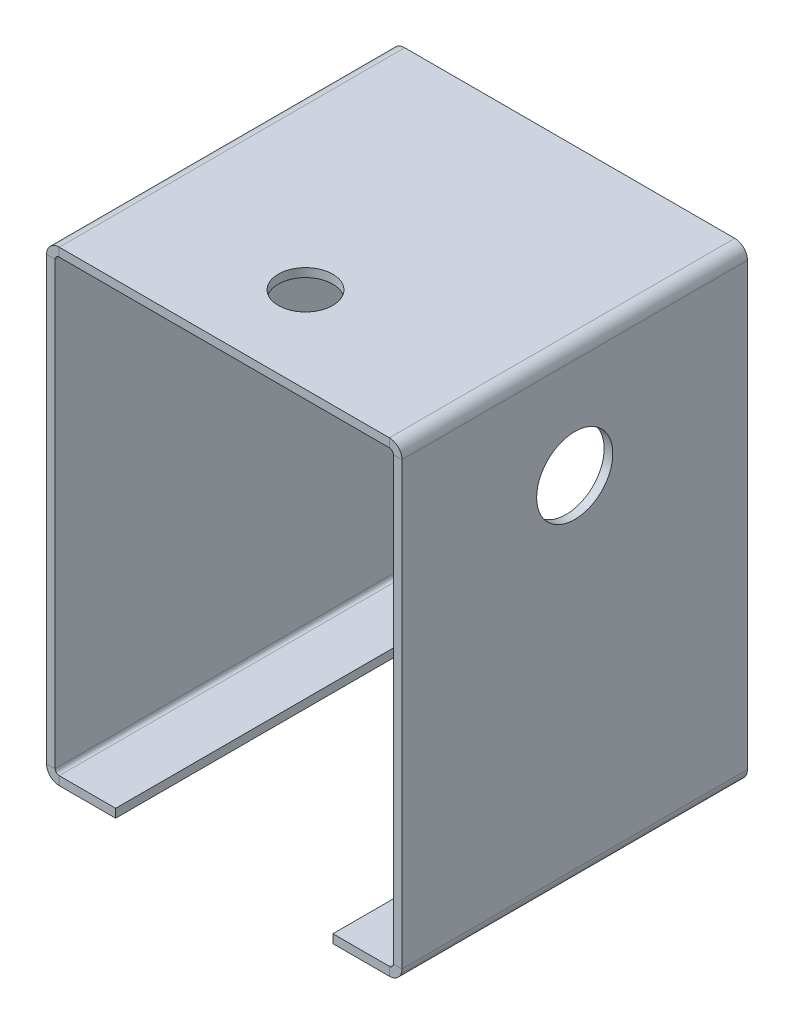
from build123d import *

# Parameters (mm, degrees)
SKETCH2_W                    = 1.5875
SKETCH2_H                    = 82.55
BASE_FLANGE1_DEPTH           = 63.5
EDGE_FLANGE1_STRIP_W         = 7.8232
EDGE_FLANGE1_STRIP_H         = 1.5875
EDGE_FLANGE1_STRIP_CUT_DEPTH = 63.5
EDGE_FLANGE1_DEPTH           = 63.5
SKETCH10_R                   = 7
CUT_EXTRUDE1_DEPTH           = 105.73891424
EDGE_FLANGE2_STRIP_W         = 7.8232
EDGE_FLANGE2_STRIP_H         = 1.5875
EDGE_FLANGE2_STRIP_CUT_DEPTH = 63.5
EDGE_FLANGE2_DEPTH           = 63.5
EDGE_FLANGE3_STRIP_W         = 7.8232
EDGE_FLANGE3_STRIP_H         = 1.5875
EDGE_FLANGE3_STRIP_CUT_DEPTH = 63.5
EDGE_FLANGE3_DEPTH           = 63.5
EDGE_FLANGE4_STRIP_W         = 7.8232
EDGE_FLANGE4_STRIP_H         = 1.5875
EDGE_FLANGE4_STRIP_CUT_DEPTH = 63.5
EDGE_FLANGE4_DEPTH           = 63.5
SKETCH20_R                   = 5
CUT_EXTRUDE2_DEPTH           = 125.278268888
SKETCH21_R                   = 5
CUT_EXTRUDE3_DEPTH           = 9.652


# Sheet-metal steps are written as plain solids
with BuildPart() as part:
    # Sketch2 → Base-Flange1 (new body)
    with BuildSketch(Plane.XY):
        with Locations((0.79375, 41.275)):
            Rectangle(SKETCH2_W, SKETCH2_H)
    extrude(amount=BASE_FLANGE1_DEPTH)

    # Edge-Flange1 strip (across the edge) → Edge-Flange1 strip cut (cut)
    with BuildSketch(Plane(origin=(0, 0, 0), x_dir=(0, 1, 0), z_dir=(0, 0, 1))):
        with Locations((-3.175, -0.79375)):
            Rectangle(EDGE_FLANGE1_STRIP_W, EDGE_FLANGE1_STRIP_H)
    extrude(amount=EDGE_FLANGE1_STRIP_CUT_DEPTH, mode=Mode.SUBTRACT)

    # Edge-Flange1 section (across the edge) → Edge-Flange1 (add)
    with BuildSketch(Plane(origin=(0, 0, 0), x_dir=(0, 1, 0), z_dir=(0, 0, 1))):
        with BuildLine():
            Line((-1.5875, 0.7366), (-1.5875, 11.1125))
            Line((-1.5875, 11.1125), (0, 11.1125))
            Line((0, 11.1125), (0, 0.7366))
            ThreePointArc((0, 0.7366), (0.215745145, 0.215745145), (0.7366, 0))
            Line((0.7366, 0), (0.7366, -1.5875))
            ThreePointArc((0.7366, -1.5875), (-0.90678687, -0.90678687), (-1.5875, 0.7366))
        make_face()
    extrude(amount=EDGE_FLANGE1_DEPTH)

    # Sketch10 → Cut-Extrude1 (cut, through all)
    with BuildSketch(Plane.ZY):
        with Locations((31.75, 63.4125)):
            Circle(SKETCH10_R)
    extrude(amount=-CUT_EXTRUDE1_DEPTH, mode=Mode.SUBTRACT)

    # Edge-Flange2 strip (across the edge) → Edge-Flange2 strip cut (cut)
    with BuildSketch(Plane(origin=(0, 82.55, 63.5), x_dir=(0, -1, 0), z_dir=(0, 0, -1))):
        with Locations((-3.175, -0.79375)):
            Rectangle(EDGE_FLANGE2_STRIP_W, EDGE_FLANGE2_STRIP_H)
    extrude(amount=EDGE_FLANGE2_STRIP_CUT_DEPTH, mode=Mode.SUBTRACT)

    # Edge-Flange2 section (across the edge) → Edge-Flange2 (add)
    with BuildSketch(Plane(origin=(0, 82.55, 63.5), x_dir=(0, -1, 0), z_dir=(0, 0, -1))):
        with BuildLine():
            Line((-1.5875, 0.7366), (-1.5875, 62.162499944))
            Line((-1.5875, 62.162499944), (0, 62.162499944))
            Line((0, 62.162499944), (0, 0.7366))
            ThreePointArc((0, 0.7366), (0.215745145, 0.215745145), (0.7366, 0))
            Line((0.7366, 0), (0.7366, -1.5875))
            ThreePointArc((0.7366, -1.5875), (-0.90678687, -0.90678687), (-1.5875, 0.7366))
        make_face()
    extrude(amount=EDGE_FLANGE2_DEPTH)

    # Edge-Flange3 strip (across the edge) → Edge-Flange3 strip cut (cut)
    with BuildSketch(Plane(origin=(-62.162499944, 82.55, 63.5), x_dir=(1, 0, 0), z_dir=(0, 0, -1))):
        with Locations((-3.175, -0.79375)):
            Rectangle(EDGE_FLANGE3_STRIP_W, EDGE_FLANGE3_STRIP_H)
    extrude(amount=EDGE_FLANGE3_STRIP_CUT_DEPTH, mode=Mode.SUBTRACT)

    # Edge-Flange3 section (across the edge) → Edge-Flange3 (add)
    with BuildSketch(Plane(origin=(-62.162499944, 82.55, 63.5), x_dir=(1, 0, 0), z_dir=(0, 0, -1))):
        with BuildLine():
            Line((-1.5875, 0.7366), (-1.5875, 82.55))
            Line((-1.5875, 82.55), (0, 82.55))
            Line((0, 82.55), (0, 0.7366))
            ThreePointArc((0, 0.7366), (0.215745145, 0.215745145), (0.7366, 0))
            Line((0.7366, 0), (0.7366, -1.5875))
            ThreePointArc((0.7366, -1.5875), (-0.90678687, -0.90678687), (-1.5875, 0.7366))
        make_face()
    extrude(amount=EDGE_FLANGE3_DEPTH)

    # Edge-Flange4 strip (across the edge) → Edge-Flange4 strip cut (cut)
    with BuildSketch(Plane(origin=(-62.162499944, 0, 63.5), x_dir=(0, 1, 0), z_dir=(0, 0, -1))):
        with Locations((-3.175, -0.79375)):
            Rectangle(EDGE_FLANGE4_STRIP_W, EDGE_FLANGE4_STRIP_H)
    extrude(amount=EDGE_FLANGE4_STRIP_CUT_DEPTH, mode=Mode.SUBTRACT)

    # Edge-Flange4 section (across the edge) → Edge-Flange4 (add)
    with BuildSketch(Plane(origin=(-62.162499944, 0, 63.5), x_dir=(0, 1, 0), z_dir=(0, 0, -1))):
        with BuildLine():
            Line((-1.5875, 0.7366), (-1.5875, 11.1125))
            Line((-1.5875, 11.1125), (0, 11.1125))
            Line((0, 11.1125), (0, 0.7366))
            ThreePointArc((0, 0.7366), (0.215745145, 0.215745145), (0.7366, 0))
            Line((0.7366, 0), (0.7366, -1.5875))
            ThreePointArc((0.7366, -1.5875), (-0.90678687, -0.90678687), (-1.5875, 0.7366))
        make_face()
    extrude(amount=EDGE_FLANGE4_DEPTH)

    # Sketch20 → Cut-Extrude2 (cut, through all)
    with BuildSketch(Plane(origin=(0, 84.1375, 0), x_dir=(1, 0, 0), z_dir=(0, 1, 0))):
        with Locations(Location((-32, -47.64999995, 0), (0, 0, 180))):
            Circle(SKETCH20_R)
    extrude(amount=-CUT_EXTRUDE2_DEPTH, mode=Mode.SUBTRACT)

    # Sketch21 → Cut-Extrude3 (cut)
    with BuildSketch(Plane(origin=(-62.162499944, 0, 0), x_dir=(0, 0, -1), z_dir=(1, 0, 0))):
        with Locations(Location((-31.75, 63.4125, 0), (0, 0, 90))):
            Circle(SKETCH21_R)
    extrude(amount=-CUT_EXTRUDE3_DEPTH, mode=Mode.SUBTRACT)


solid = part.part
